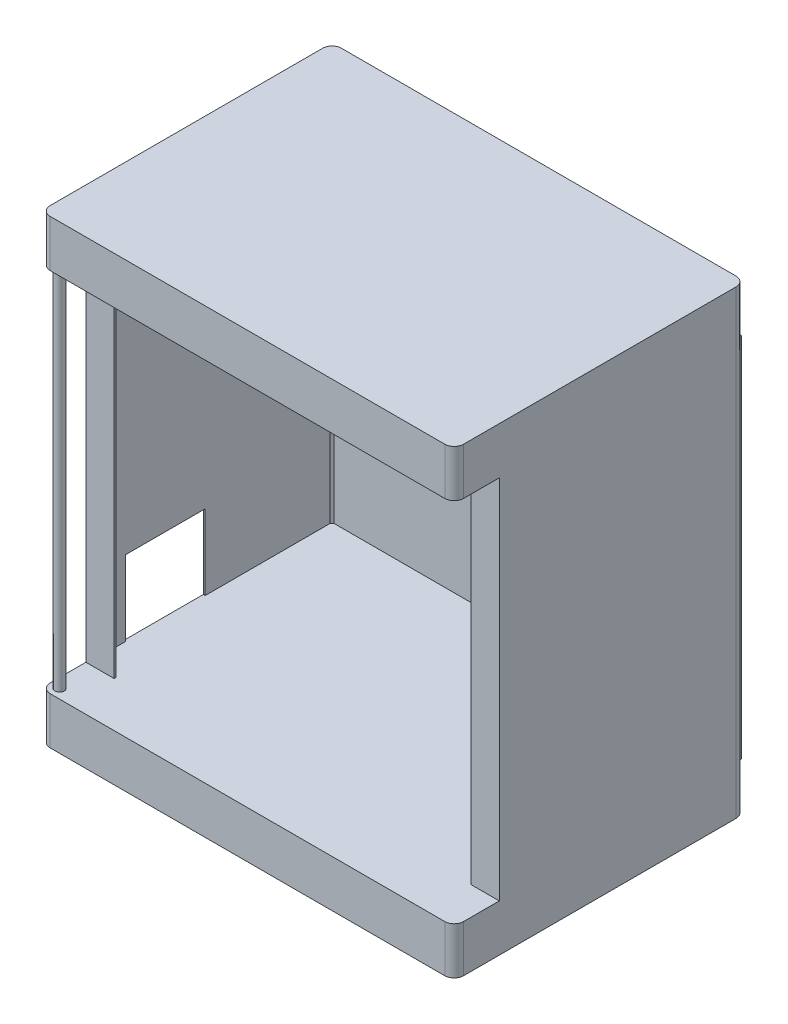
from build123d import *

# Parameters (mm, degrees)
SKETCH1_W           = 440
SKETCH1_H           = 310
BOSS_EXTRUDE1_DEPTH = 490
SHELL1_START        = -218
SHELL1_OUTLINE_W    = 390
SHELL1_OUTLINE_H    = 308
SHELL1_DEPTH        = 436
SKETCH3_W           = 440
SKETCH3_H           = 390
CUT_EXTRUDE1_DEPTH  = 50
SKETCH4_W           = 30
SKETCH4_H           = 390
BOSS_EXTRUDE2_DEPTH = 2
SKETCH5_W           = 30
SKETCH5_H           = 390
BOSS_EXTRUDE3_DEPTH = 2
SKETCH7_R           = 5
BOSS_EXTRUDE4_DEPTH = 440
FILLET1_R           = 10
FILLET2_R           = 10
CUT_EXTRUDE2_REACH  = 678.554
SKETCH8_W           = 85
SKETCH8_H           = 80


# Read off the part's stored shape, not the designer's step: Shell1
with BuildPart() as part:
    # Sketch1 → Boss-Extrude1 (new body)
    with BuildSketch(Plane(origin=(0, 0, 0), x_dir=(1, 0, 0), z_dir=(0, 1, 0))):
        Rectangle(SKETCH1_W, SKETCH1_H)
    extrude(amount=BOSS_EXTRUDE1_DEPTH)

    # Shell1 outline → Shell1 (cut)
    with BuildSketch(Plane.YZ.offset(SHELL1_START)):
        with Locations((245, 1)):
            Rectangle(SHELL1_OUTLINE_W, SHELL1_OUTLINE_H)
    extrude(amount=SHELL1_DEPTH, mode=Mode.SUBTRACT)

    # Sketch3 → Cut-Extrude1 (cut)
    with BuildSketch(Plane.XY.offset(155)):
        with Locations((0, 245)):
            Rectangle(SKETCH3_W, SKETCH3_H)
    extrude(amount=-CUT_EXTRUDE1_DEPTH, mode=Mode.SUBTRACT)

    # Sketch4 → Boss-Extrude2 (add)
    with BuildSketch(Plane.XY.offset(105)):
        with Locations((-205, 245)):
            Rectangle(SKETCH4_W, SKETCH4_H)
    extrude(amount=BOSS_EXTRUDE2_DEPTH)

    # Sketch5 → Boss-Extrude3 (add)
    with BuildSketch(Plane.XY.offset(105)):
        with Locations((205, 245)):
            Rectangle(SKETCH5_W, SKETCH5_H)
    extrude(amount=BOSS_EXTRUDE3_DEPTH)

    # Sketch7 → Boss-Extrude4 (add)
    with BuildSketch(Plane(origin=(0, 50, 0), x_dir=(1, 0, 0), z_dir=(0, 1, 0))):
        with Locations(Location((-210, -145, 0), (0, 0, 90))):
            Circle(SKETCH7_R)
    extrude(amount=BOSS_EXTRUDE4_DEPTH)

    # Fillet1
    fillet1_edges = [part.edges().sort_by_distance(p)[0] for p in [
        (-220, 25, 155),
        (220, 25, 155),
        (220, 465, 155),
        (-220, 465, 155),
    ]]
    fillet(fillet1_edges, radius=FILLET1_R)

    # Fillet2
    fillet2_edges = [part.edges().sort_by_distance(p)[0] for p in [
        (-220, 245, -155),
        (220, 245, -155),
    ]]
    fillet(fillet2_edges, radius=FILLET2_R)

    # Sketch8 → Cut-Extrude2 (cut, up to next)
    with BuildSketch(Plane.ZY.offset(220), mode=Mode.PRIVATE) as cut_extrude2_sk1:
        with Locations((24.5, 90)):
            Rectangle(SKETCH8_W, SKETCH8_H)
    cut_extrude2_tool1 = extrude(cut_extrude2_sk1.sketch, amount=-CUT_EXTRUDE2_REACH, mode=Mode.PRIVATE) & part.part
    add(cut_extrude2_tool1.solids().sort_by_distance((-220, 90, 24.5))[0], mode=Mode.SUBTRACT)


solid = part.part
